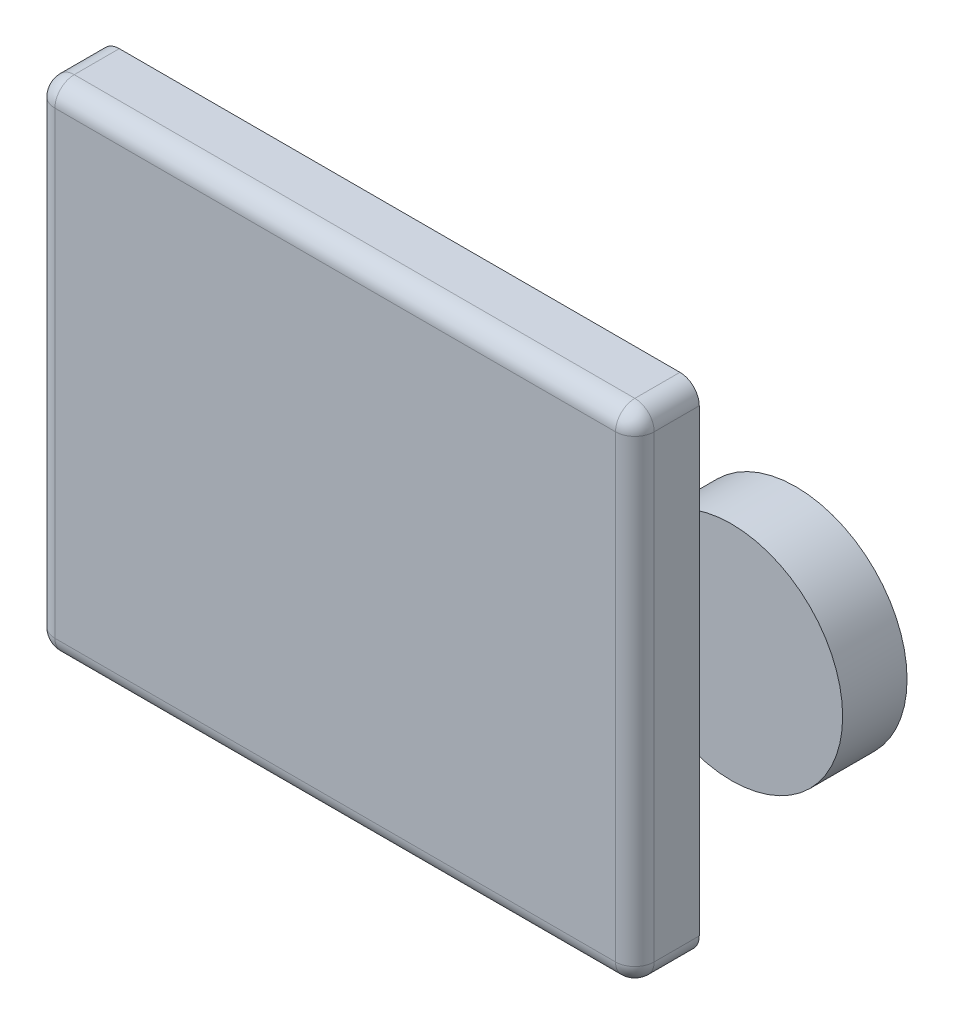
from build123d import *

# Parameters (mm, degrees)
F_1_FR_W        = 93.042145165
F_1_FR_H        = 77.277529207
EXTRUDE_1_DEPTH = 10
SKETCH_5_R      = 17.261773312
EXTRUDE_2_DEPTH = 10
FILLET_1_R      = 3
FILLET_2_R      = 3
FILLET_3_R      = 3


with BuildPart() as part:
    # Эскиз1_fr → Бобышка-Вытянуть1 (new body)
    with BuildSketch(Plane.XY):
        with Locations((-2.472880935, -0.618220234)):
            Rectangle(F_1_FR_W, F_1_FR_H)
    extrude(amount=EXTRUDE_1_DEPTH)

    # Скругление1
    fillet_1_edges = [part.edges().sort_by_distance(p)[0] for p in [
        (44.048191648, -0.618220234, 10),
        (-2.472880935, 38.02054437, 10),
        (-48.993953517, -0.618220234, 10),
        (-2.472880935, -39.256984837, 10),
    ]]
    fillet(fillet_1_edges, radius=FILLET_1_R)

    # Скругление2
    # the kernel refuses this fillet: 3 mm, written as the material it takes off along each edge
    with BuildSketch(Plane(origin=(41.048191648, -36.256984837, 7), x_dir=(0, -1, 0), z_dir=(1, 0, 0))) as fillet_2_piece_1_section:
        Polygon((0, 0), (FILLET_2_R, 0), (FILLET_2_R, -FILLET_2_R), (0, -FILLET_2_R), align=None)
    fillet_2_piece_1 = extrude(amount=FILLET_2_R, mode=Mode.PRIVATE)
    fillet_2_piece_1 = fillet_2_piece_1 - Plane(origin=(41.048191648, -36.256984837, 7), x_dir=(0, 0.7071067811865475, -0.7071067811865475), z_dir=(1, 0, 0)) * Sphere(FILLET_2_R, mode=Mode.PRIVATE)
    add(fillet_2_piece_1, mode=Mode.SUBTRACT)
    with BuildSketch(Plane(origin=(44.048191648, -39.256984837, -7.5), x_dir=(0, 1, 0), z_dir=(0, 0, 1))) as fillet_2_piece_2:
        with BuildLine():
            CenterArc((FILLET_2_R, FILLET_2_R), FILLET_2_R, 180, 90)
            Line((0, FILLET_2_R), (0, 0))
            Line((0, 0), (FILLET_2_R, 0))
        make_face()
    extrude(amount=14.5, mode=Mode.SUBTRACT)

    # Скругление3
    # the kernel refuses this fillet: 3 mm, written as the material it takes off along each edge
    with BuildSketch(Plane(origin=(-45.993953517, -36.256984837, 7), x_dir=(0, -1, 0), z_dir=(-1, 0, 0))) as fillet_3_piece_1_section:
        Polygon((0, 0), (FILLET_3_R, 0), (FILLET_3_R, FILLET_3_R), (0, FILLET_3_R), align=None)
    fillet_3_piece_1 = extrude(amount=FILLET_3_R, mode=Mode.PRIVATE)
    fillet_3_piece_1 = fillet_3_piece_1 - Plane(origin=(-45.993953517, -36.256984837, 7), x_dir=(0, 0.7071067811865475, -0.7071067811865475), z_dir=(-1, 0, 0)) * Sphere(FILLET_3_R, mode=Mode.PRIVATE)
    add(fillet_3_piece_1, mode=Mode.SUBTRACT)
    with BuildSketch(Plane(origin=(41.048191648, 35.02054437, 7), x_dir=(1, 0, 0), z_dir=(0, 1, 0))) as fillet_3_piece_2_section:
        Polygon((0, 0), (FILLET_3_R, 0), (FILLET_3_R, -FILLET_3_R), (0, -FILLET_3_R), align=None)
    fillet_3_piece_2 = extrude(amount=FILLET_3_R, mode=Mode.PRIVATE)
    fillet_3_piece_2 = fillet_3_piece_2 - Plane(origin=(41.048191648, 35.02054437, 7), x_dir=(-0.7071067811865475, 0, -0.7071067811865475), z_dir=(0, 1, 0)) * Sphere(FILLET_3_R, mode=Mode.PRIVATE)
    add(fillet_3_piece_2, mode=Mode.SUBTRACT)
    with BuildSketch(Plane(origin=(-45.993953517, 35.02054437, 7), x_dir=(-1, 0, 0), z_dir=(0, 1, 0))) as fillet_3_piece_3_section:
        Polygon((0, 0), (FILLET_3_R, 0), (FILLET_3_R, FILLET_3_R), (0, FILLET_3_R), align=None)
    fillet_3_piece_3 = extrude(amount=FILLET_3_R, mode=Mode.PRIVATE)
    fillet_3_piece_3 = fillet_3_piece_3 - Plane(origin=(-45.993953517, 35.02054437, 7), x_dir=(0.7071067811865475, 0, -0.7071067811865475), z_dir=(0, 1, 0)) * Sphere(FILLET_3_R, mode=Mode.PRIVATE)
    add(fillet_3_piece_3, mode=Mode.SUBTRACT)
    with BuildSketch(Plane(origin=(-48.993953517, 38.02054437, -7.5), x_dir=(1, 0, 0), z_dir=(0, 0, 1)), Plane(origin=(-48.993953517, -39.256984837, -7.5), x_dir=(0, 1, 0), z_dir=(0, 0, 1))) as fillet_3_piece_4:
        with BuildLine():
            CenterArc((FILLET_3_R, -FILLET_3_R), FILLET_3_R, 90, 90)
            Line((0, -FILLET_3_R), (0, 0))
            Line((0, 0), (FILLET_3_R, 0))
        make_face()
    extrude(amount=14.5, mode=Mode.SUBTRACT)
    with BuildSketch(Plane(origin=(44.048191648, 38.02054437, -7.5), x_dir=(-1, 0, 0), z_dir=(0, 0, 1))) as fillet_3_piece_5:
        with BuildLine():
            CenterArc((FILLET_3_R, FILLET_3_R), FILLET_3_R, 180, 90)
            Line((0, FILLET_3_R), (0, 0))
            Line((0, 0), (FILLET_3_R, 0))
        make_face()
    extrude(amount=14.5, mode=Mode.SUBTRACT)


with BuildPart() as body_2:
    # Эскиз5 → Бобышка-Вытянуть2 (new body)
    with BuildSketch(Plane.XY.offset(-5)):
        with Locations((44.048191648, -0.618220234)):
            Circle(SKETCH_5_R)
    extrude(amount=-EXTRUDE_2_DEPTH)


solid = Compound([part.part, body_2.part])
